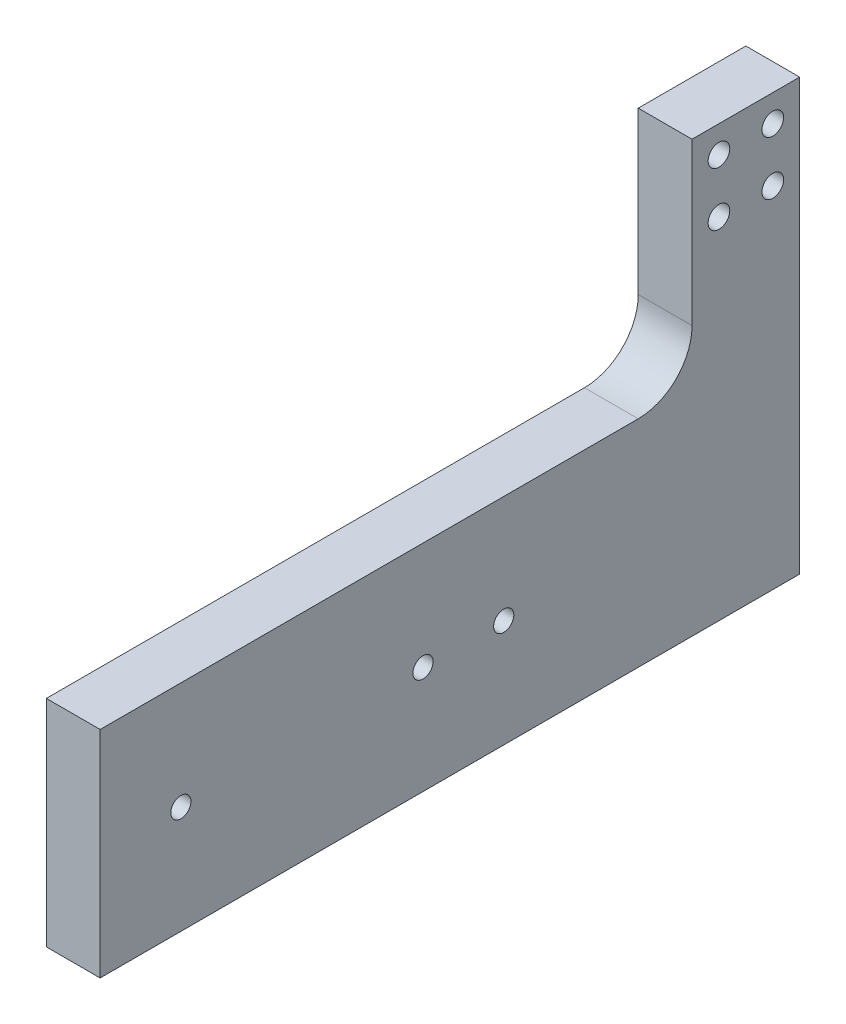
from build123d import *

# Parameters (mm, degrees)
SKETCH1_R              = 2.38125
BOSS_EXTRUDE1_DEPTH    = 12.7
F_10_CLEARANCE_HOLE1_D = 5.1054
FILLET1_R              = 12.7


with BuildPart() as part:
    # Sketch1 → Boss-Extrude1 (new body)
    with BuildSketch(Plane(origin=(0, 0, 0), x_dir=(0, 0, -1), z_dir=(1, 0, 0))):
        Polygon((0, 0), (0, 101.6), (-25.4, 101.6), (-25.4, 50.8), (-165.1, 50.8), (-165.1, 0), align=None)
        with Locations((-146.05, 25.4)):
            Circle(SKETCH1_R, mode=Mode.SUBTRACT)
        with Locations((-88.9, 25.4)):
            Circle(SKETCH1_R, mode=Mode.SUBTRACT)
        with Locations((-69.85, 25.4)):
            Circle(SKETCH1_R, mode=Mode.SUBTRACT)
    extrude(amount=BOSS_EXTRUDE1_DEPTH)

    # #10 Clearance Hole1 (through all)
    with Locations(Plane(origin=(12.7, 0, 0), x_dir=(0, 0, -1), z_dir=(1, 0, 0))):
        with Locations((-19.05, 95.25), (-6.35, 95.25), (-6.35, 82.55), (-19.05, 82.55)):
            Hole(F_10_CLEARANCE_HOLE1_D / 2)

    # Fillet1
    fillet1_edges = [part.edges().sort_by_distance(p)[0] for p in [
        (6.35, 50.8, 25.4),
    ]]
    fillet(fillet1_edges, radius=FILLET1_R)


solid = part.part
